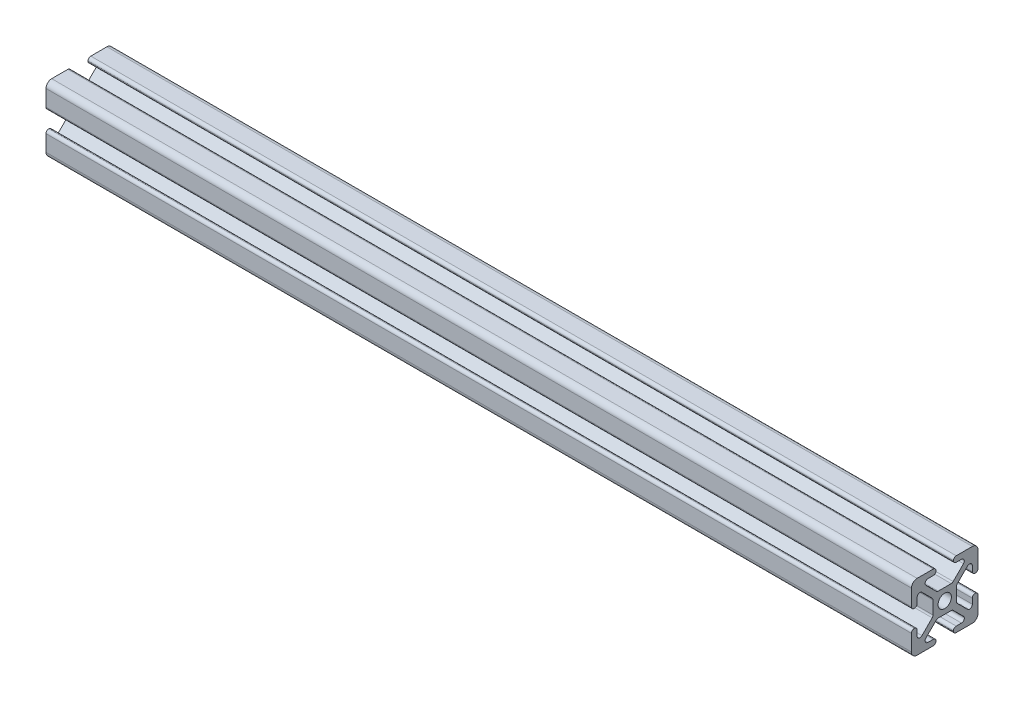
from build123d import *

# Parameters (mm, degrees)
SKETCH1_R           = 2.5
BOSS_EXTRUDE1_DEPTH = 325
FILLET1_R           = 1.065
FILLET2_R           = 2.13


with BuildPart() as part:
    # Sketch1 → Boss-Extrude1 (new body)
    with BuildSketch(Plane.YZ):
        Polygon((-12.5, -3.25), (-12.5, -12.5), (-3.25, -12.5), (-3.25, -10.37), (-8.863862556, -10.37), (-2.873862556, -4.38), (2.873862556, -4.38), (8.863862556, -10.37), (3.25, -10.37), (3.25, -12.5), (12.5, -12.5), (12.5, -3.25), (10.37, -3.25), (10.37, -8.863862556), (4.38, -2.873862556), (4.38, 2.873862556), (10.37, 8.863862556), (10.37, 3.25), (12.5, 3.25), (12.5, 12.5), (3.25, 12.5), (3.25, 10.37), (8.863862556, 10.37), (2.873862556, 4.38), (-2.873862556, 4.38), (-8.863862556, 10.37), (-3.25, 10.37), (-3.25, 12.5), (-12.5, 12.5), (-12.5, 3.25), (-10.37, 3.25), (-10.37, 8.863862556), (-4.38, 2.873862556), (-4.38, -2.873862556), (-10.37, -8.863862556), (-10.37, -3.25), align=None)
        with Locations(Location((0, 0, 0), (0, 0, 270))):
            Circle(SKETCH1_R, mode=Mode.SUBTRACT)
    extrude(amount=BOSS_EXTRUDE1_DEPTH)

    # Fillet1
    fillet1_edges = [part.edges().sort_by_distance(p)[0] for p in [
        (162.5, -10.37, -8.863862556),
        (162.5, 2.873862556, -4.38),
        (162.5, -2.873862556, -4.38),
        (162.5, -4.38, 2.873862556),
        (162.5, -4.38, -2.873862556),
        (162.5, -2.873862556, 4.38),
        (162.5, 2.873862556, 4.38),
        (162.5, 4.38, 2.873862556),
        (162.5, 4.38, -2.873862556),
        (162.5, -8.863862556, -10.37),
        (162.5, 8.863862556, -10.37),
        (162.5, 10.37, -8.863862556),
        (162.5, -10.37, 8.863862556),
        (162.5, -8.863862556, 10.37),
        (162.5, 10.37, 8.863862556),
        (162.5, 8.863862556, 10.37),
        (162.5, 12.5, 3.25),
        (162.5, -3.25, -12.5),
        (162.5, -10.37, 3.25),
        (162.5, 10.37, 3.25),
        (162.5, -10.37, -3.25),
        (162.5, -12.5, -3.25),
        (162.5, -12.5, 3.25),
        (162.5, 3.25, -10.37),
        (162.5, -3.25, -10.37),
        (162.5, 3.25, -12.5),
        (162.5, 10.37, -3.25),
        (162.5, 12.5, -3.25),
        (162.5, 3.25, 12.5),
        (162.5, 3.25, 10.37),
        (162.5, -3.25, 10.37),
        (162.5, -3.25, 12.5),
    ]]
    fillet(fillet1_edges, radius=FILLET1_R - 0.0001)  # a hair under: the kernel refuses the full size

    # Fillet2
    fillet2_edges = [part.edges().sort_by_distance(p)[0] for p in [
        (162.5, -12.5, 12.5),
        (162.5, 12.5, 12.5),
        (162.5, 12.5, -12.5),
        (162.5, -12.5, -12.5),
    ]]
    fillet(fillet2_edges, radius=FILLET2_R)


solid = part.part
